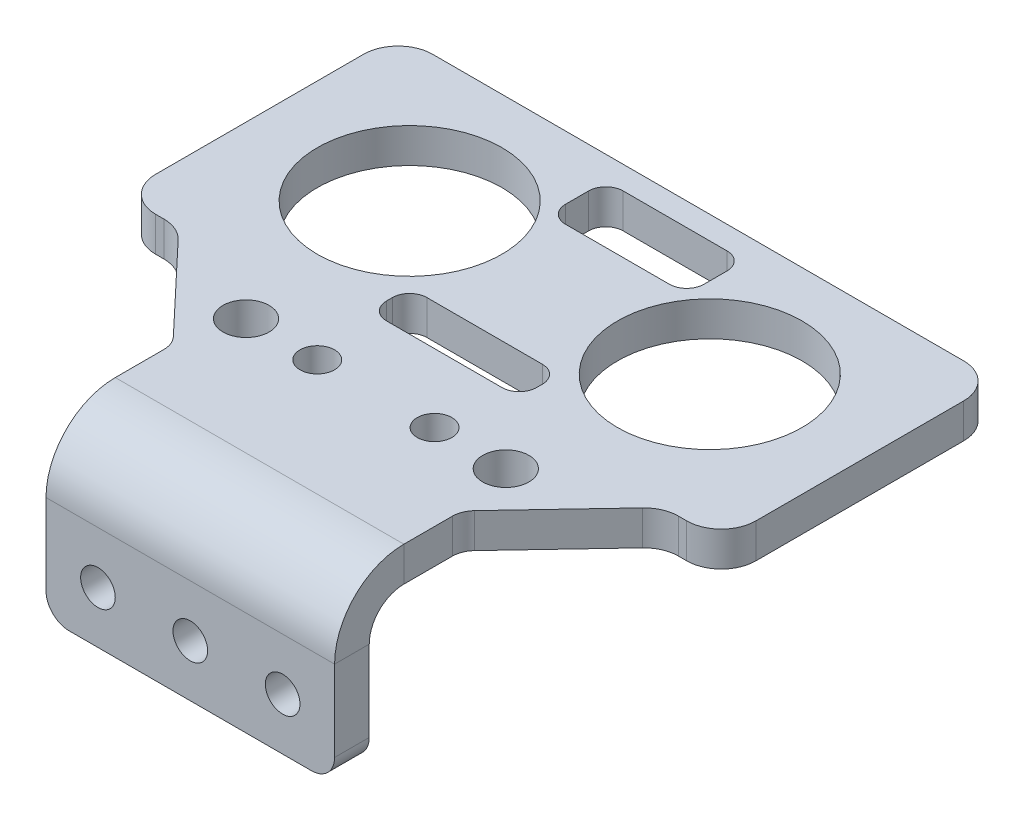
from build123d import *

# Parameters (mm, degrees)
CROQUIS11_R             = 2
CROQUIS11_R_2           = 1.5
CROQUIS11_R_3           = 9
SALIENTE_EXTRUIR1_DEPTH = 3
REDONDEO1_R             = 3
BOSS_EXTRUDE1_START     = -3
SKETCH1_R               = 9
SKETCH1_R_2             = 8
BOSS_EXTRUDE1_DEPTH     = 3
SKETCH2_W               = 25
SKETCH2_H               = 3
BOSS_EXTRUDE2_DEPTH     = 5
EDGE_FLANGE1_DEPTH      = 25
SKETCH10_R              = 1.5
CUT_EXTRUDE1_DEPTH      = 3
FILLET1_R               = 2


# Sheet-metal steps are written as plain solids
with BuildPart() as part:
    # Croquis11 → Saliente-Extruir1 (new body)
    with BuildSketch(Plane(origin=(0, 0, 0), x_dir=(1, 0, 0), z_dir=(0, 1, 0))):
        Polygon((-26, 18), (-21, 18), (-12.5, 9), (12.5, 9), (21, 18), (26, 18), (26, 42), (-26, 42), align=None)
        with Locations(Location((-11.25, 14.08, 0), (0, 0, 270))):
            Circle(CROQUIS11_R, mode=Mode.SUBTRACT)
        with Locations(Location((-5.08, 14.08, 0), (0, 0, 270))):
            Circle(CROQUIS11_R_2, mode=Mode.SUBTRACT)
        with Locations(Location((5.08, 14.08, 0), (0, 0, 90))):
            Circle(CROQUIS11_R_2, mode=Mode.SUBTRACT)
        with Locations(Location((11.25, 14.08, 0), (0, 0, 90))):
            Circle(CROQUIS11_R, mode=Mode.SUBTRACT)
        with Locations(Location((13, 30, 0), (0, 0, 270))):
            Circle(CROQUIS11_R_3, mode=Mode.SUBTRACT)
        with Locations(Location((-13, 30, 0), (0, 0, 270))):
            Circle(CROQUIS11_R_3, mode=Mode.SUBTRACT)
        with BuildLine():
            Line((-6, 38.5), (-6, 36.5))
            ThreePointArc((-6, 36.5), (-5.560660172, 35.439339828), (-4.5, 35))
            Line((-4.5, 35), (4.5, 35))
            ThreePointArc((4.5, 35), (5.560660172, 35.439339828), (6, 36.5))
            Line((6, 36.5), (6, 38.5))
            ThreePointArc((6, 38.5), (5.560660172, 39.560660172), (4.5, 40))
            Line((4.5, 40), (-4.5, 40))
            ThreePointArc((-4.5, 40), (-5.560660172, 39.560660172), (-6, 38.5))
        make_face(mode=Mode.SUBTRACT)
        with BuildLine():
            Line((6.5, 22), (6.5, 21.5))
            ThreePointArc((6.5, 21.5), (6.060660172, 20.439339828), (5, 20))
            Line((5, 20), (-5, 20))
            ThreePointArc((-5, 20), (-6.060660172, 20.439339828), (-6.5, 21.5))
            Line((-6.5, 21.5), (-6.5, 22))
            ThreePointArc((-6.5, 22), (-6.060660172, 23.060660172), (-5, 23.5))
            Line((-5, 23.5), (5, 23.5))
            ThreePointArc((5, 23.5), (6.060660172, 23.060660172), (6.5, 22))
        make_face(mode=Mode.SUBTRACT)
    extrude(amount=SALIENTE_EXTRUIR1_DEPTH)

    # Redondeo1
    redondeo1_edges = [part.edges().sort_by_distance(p)[0] for p in [
        (26, 1.5, -18),
        (21, 1.5, -18),
        (-21, 1.5, -18),
        (-26, 1.5, -18),
        (-26, 1.5, -42),
        (26, 1.5, -42),
    ]]
    fillet(redondeo1_edges, radius=REDONDEO1_R)

    # Sketch1 → Boss-Extrude1 (add)
    # profile 1 of 2: a face of its own
    with BuildSketch(Plane(origin=(0, 3, 0), x_dir=(1, 0, 0), z_dir=(0, 1, 0)).offset(BOSS_EXTRUDE1_START)):
        with Locations((-13, 30)):
            Circle(SKETCH1_R)
        with Locations(Location((-13, 30, 0), (0, 0, 270))):
            Circle(SKETCH1_R_2, mode=Mode.SUBTRACT)
    # profile 2 of 2: a face of its own
    with BuildSketch(Plane(origin=(0, 3, 0), x_dir=(1, 0, 0), z_dir=(0, 1, 0)).offset(BOSS_EXTRUDE1_START)):
        with Locations((13, 30)):
            Circle(SKETCH1_R)
        with Locations(Location((13, 30, 0), (0, 0, 270))):
            Circle(SKETCH1_R_2, mode=Mode.SUBTRACT)
    extrude(amount=BOSS_EXTRUDE1_DEPTH)

    # Sketch2 → Boss-Extrude2 (add)
    with BuildSketch(Plane.XY.offset(-9)):
        with Locations((0, 1.5)):
            Rectangle(SKETCH2_W, SKETCH2_H)
    extrude(amount=BOSS_EXTRUDE2_DEPTH)

    # Edge-Flange1 section (across the edge) → Edge-Flange1 (add)
    with BuildSketch(Plane(origin=(12.5, 0, -1), x_dir=(0, 0, -1), z_dir=(-1, 0, 0))):
        with BuildLine():
            Line((-3, 3), (-3, 12))
            Line((-3, 12), (0, 12))
            Line((0, 12), (0, 3))
            ThreePointArc((0, 3), (0.878679656, 0.878679656), (3, 0))
            Line((3, 0), (3, -3))
            ThreePointArc((3, -3), (-1.242640687, -1.242640687), (-3, 3))
        make_face()
    extrude(amount=EDGE_FLANGE1_DEPTH)

    # Sketch10 → Cut-Extrude1 (cut)
    with BuildSketch(Plane.XY.offset(2)):
        with Locations((0, -7.5)):
            Circle(SKETCH10_R)
        with Locations((-8, -7.5)):
            Circle(SKETCH10_R)
        with Locations((8, -7.5)):
            Circle(SKETCH10_R)
    extrude(amount=-CUT_EXTRUDE1_DEPTH, mode=Mode.SUBTRACT)

    # Fillet1
    fillet1_edges = [part.edges().sort_by_distance(p)[0] for p in [
        (12.5, 1.5, -9),
        (-12.5, 1.5, -9),
        (12.5, -12, 0.5),
        (-12.5, -12, 0.5),
    ]]
    fillet(fillet1_edges, radius=FILLET1_R)


solid = part.part
